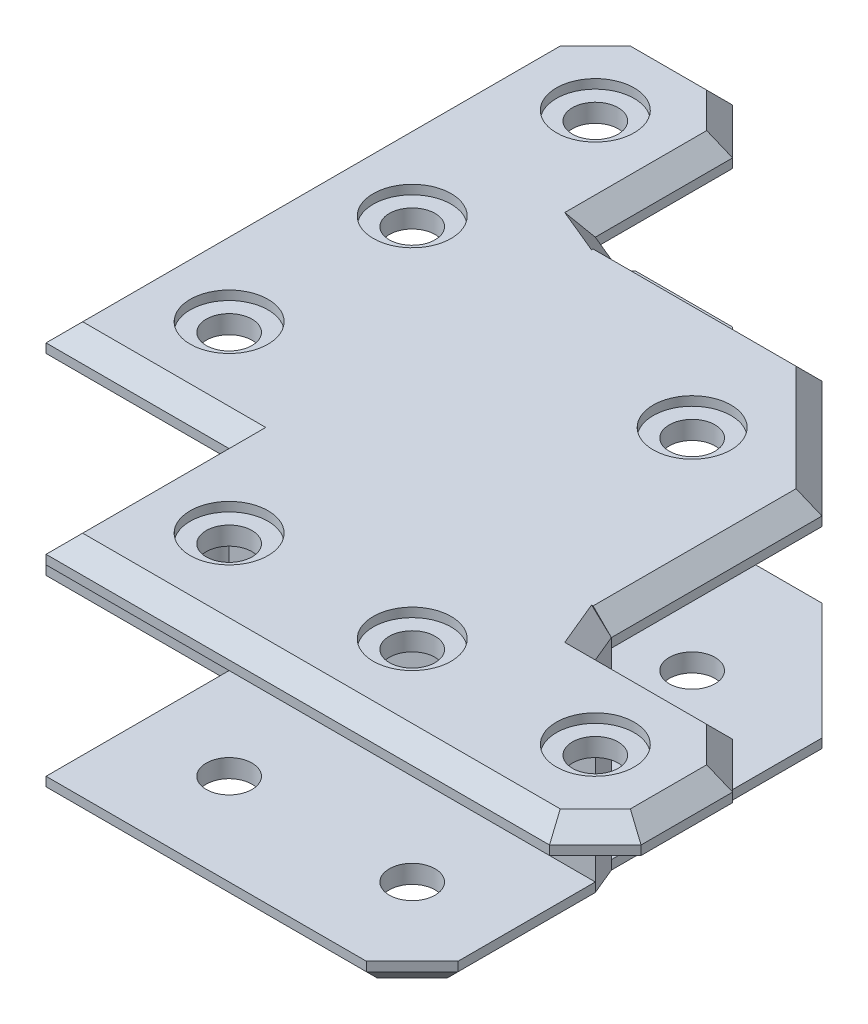
from build123d import *
from OCP.BRepFilletAPI import BRepFilletAPI_MakeChamfer

# Parameters (mm, degrees)
SKETCH1_W                    = 20
SKETCH1_H                    = 80
SKETCH1_W_2                  = 60
SKETCH1_H_2                  = 20
BOSS_EXTRUDE1_DEPTH          = 3
EXTRUDE_THIN10_DEPTH         = 3
SKETCH5_W                    = 20
SKETCH5_H                    = 20
CUT_EXTRUDE2_DEPTH           = 3
SKETCH6_R                    = 2.5
CUT_EXTRUDE3_DEPTH           = 10
BOSS_EXTRUDE7_DEPTH          = 23
SKETCH8_W                    = 0.297396294
SKETCH8_H                    = 3
BOSS_EXTRUDE8_DEPTH          = 23
SKETCH13_W                   = 3
SKETCH13_H                   = 35.56274761
BOSS_EXTRUDE9_DEPTH          = 26
SKETCH14_W                   = 3
SKETCH14_H                   = 1.444164959
BOSS_EXTRUDE10_DEPTH         = 23
CUT_EXTRUDE_THIN2_DEPTH      = 116.451288429
CUT_EXTRUDE_THIN2_DEPTH_BACK = 31
SKETCH16_W                   = 60
SKETCH16_H                   = 20
BOSS_EXTRUDE11_DEPTH         = 3
SKETCH18_W                   = 1.4
SKETCH18_H                   = 3
BOSS_EXTRUDE12_DEPTH         = 23
SKETCH19_R                   = 2.5
CUT_EXTRUDE10_DEPTH          = 30
SKETCH20_W                   = 20
SKETCH20_H                   = 60
BOSS_EXTRUDE13_DEPTH         = 3
SKETCH21_R                   = 2.5
CUT_EXTRUDE12_DEPTH          = 3
SKETCH22_R                   = 2.5
CUT_EXTRUDE13_DEPTH          = 3
SKETCH23_R                   = 2.5
CUT_EXTRUDE14_DEPTH          = 3
CUT_EXTRUDE_THIN3_DEPTH      = 117.086174887
CUT_EXTRUDE_THIN3_DEPTH_BACK = 3
CUT_EXTRUDE_THIN4_DEPTH      = 117.086174887
CUT_EXTRUDE_THIN4_DEPTH_BACK = 30
CUT_EXTRUDE_THIN5_START      = -58
CUT_EXTRUDE_THIN5_OUTLINE_W  = 10
CUT_EXTRUDE_THIN5_OUTLINE_H  = 29
CUT_EXTRUDE_THIN5_DEPTH      = 4.521306028
CUT_EXTRUDE_THIN6_DEPTH      = 117.086174887
CUT_EXTRUDE_THIN6_DEPTH_BACK = 30
SKETCH31_W                   = 21
SKETCH31_H                   = 20
CUT_EXTRUDE_THIN7_DEPTH      = 3
CUT_EXTRUDE15_DEPTH          = 117.086174887
CUT_EXTRUDE15_DEPTH_BACK     = 3
CHAMFER12_SIZE               = 2
CHAMFER13_SIZE               = 2
CHAMFER14_SIZE               = 2
CHAMFER17_SIZE               = 2
CHAMFER19_SIZE               = 2
SKETCH34_R                   = 4.25
SKETCH34_R_2                 = 2.5
CUT_EXTRUDE16_DEPTH          = 1
CUT_EXTRUDE17_START          = -1
SKETCH35_R                   = 4.25
CUT_EXTRUDE17_DEPTH          = 1
SKETCH37_R                   = 4.25
CUT_EXTRUDE18_DEPTH          = 1
SKETCH38_R                   = 4.25
CUT_EXTRUDE19_DEPTH          = 1
BOSS_EXTRUDE16_DEPTH         = 3
SKETCH41_W                   = 37.632579405
SKETCH41_H                   = 10.938249111
CUT_EXTRUDE20_DEPTH          = 40
SKETCH44_W                   = 41
SKETCH44_H                   = 23
EXTRUDE_THIN11_DEPTH         = 3
EXTRUDE_THIN12_DEPTH         = 3
CHAMFER20_SIZE               = 2
CHAMFER21_SIZE               = 2
CHAMFER21_SIZE2              = 1.965988204
CHAMFER21_SIZE2_2            = 2.035840382
CHAMFER22_SIZE               = 2
CHAMFER23_SIZE               = 2
CUT_EXTRUDE28_DEPTH          = 1
SKETCH45_R                   = 2.5
CUT_EXTRUDE29_DEPTH          = 41
SKETCH47_R                   = 4.25
CUT_EXTRUDE30_DEPTH          = 1


with BuildPart() as part:
    # Sketch1 → Boss-Extrude1 (new body)
    with BuildSketch(Plane(origin=(0, 0, 0), x_dir=(1, 0, 0), z_dir=(0, 1, 0))):
        with Locations((10, 40)):
            Rectangle(SKETCH1_W, SKETCH1_H)
        with Locations((50, 10)):
            Rectangle(SKETCH1_W_2, SKETCH1_H_2)
    extrude(amount=BOSS_EXTRUDE1_DEPTH)

    # Sketch3 → Extrude-Thin10 (add)
    with BuildSketch(Plane(origin=(0, 3, 0), x_dir=(1, 0, 0), z_dir=(0, 1, 0))):
        Polygon((20, 60.000000002), (48.284271248, 48.28427125), (60, 20), (23.044818699, 4.692662707), (17.669596658, 17.669596661), (4.692662706, 23.044818701), align=None)
    extrude(amount=-EXTRUDE_THIN10_DEPTH)

    # Sketch5 → Cut-Extrude2 (cut)
    with BuildSketch(Plane(origin=(0, 0, 0), x_dir=(1, 0, 0), z_dir=(0, 1, 0))):
        with Locations((10, 10)):
            Rectangle(SKETCH5_W, SKETCH5_H)
    extrude(amount=CUT_EXTRUDE2_DEPTH, mode=Mode.SUBTRACT)

    # Sketch6 → Cut-Extrude3 (cut)
    with BuildSketch(Plane(origin=(0, 3, 0), x_dir=(1, 0, 0), z_dir=(0, 1, 0))):
        with Locations(Location((30, 10, 0), (0, 0, 270))):
            Circle(SKETCH6_R)
        with Locations(Location((50, 10, 0), (0, 0, 270))):
            Circle(SKETCH6_R)
        with Locations(Location((70, 10, 0), (0, 0, 270))):
            Circle(SKETCH6_R)
        with Locations(Location((10, 30, 0), (0, 0, 270))):
            Circle(SKETCH6_R)
        with Locations(Location((10, 50, 0), (0, 0, 270))):
            Circle(SKETCH6_R)
        with Locations(Location((10, 70, 0), (0, 0, 270))):
            Circle(SKETCH6_R)
    extrude(amount=-CUT_EXTRUDE3_DEPTH, mode=Mode.SUBTRACT)

    # Sketch7 → Boss-Extrude7 (add)
    with BuildSketch(Plane(origin=(0, 3, 0), x_dir=(1, 0, 0), z_dir=(0, 1, 0))):
        Polygon((21.395504865, 23), (21.395504865, 20), (60, 20), (58.757359313, 23), align=None)
    extrude(amount=BOSS_EXTRUDE7_DEPTH)

    # Sketch8 → Boss-Extrude8 (add)
    with BuildSketch(Plane(origin=(0, 0, 0), x_dir=(1, 0, 0), z_dir=(0, 1, 0))):
        with Locations((20.148698147, 21.5)):
            Rectangle(SKETCH8_W, SKETCH8_H)
    extrude(amount=BOSS_EXTRUDE8_DEPTH)

    # Sketch13 → Boss-Extrude9 (add)
    with BuildSketch(Plane(origin=(0, 0, 0), x_dir=(1, 0, 0), z_dir=(0, 1, 0))):
        with Locations((21.5, 40.781373805)):
            Rectangle(SKETCH13_W, SKETCH13_H)
    extrude(amount=BOSS_EXTRUDE9_DEPTH)

    # Sketch14 → Boss-Extrude10 (add)
    with BuildSketch(Plane(origin=(0, 3, 0), x_dir=(1, 0, 0), z_dir=(0, 1, 0))):
        with Locations((21.5, 59.277917521)):
            Rectangle(SKETCH14_W, SKETCH14_H)
    extrude(amount=BOSS_EXTRUDE10_DEPTH)

    # Sketch15 → Cut-Extrude-Thin2 (cut, two sides: drawn at the far end of the back side and taken through both)
    with BuildSketch(Plane(origin=(0, 3, 0), x_dir=(-1, 0, 0), z_dir=(0, -1, 0)).offset(-CUT_EXTRUDE_THIN2_DEPTH_BACK)):
        Polygon((-20, 60), (-48.28, 48.28), (-49.42855555, 51.051429261), (-21.14855555, 62.771429261), align=None)
    extrude(amount=CUT_EXTRUDE_THIN2_DEPTH + CUT_EXTRUDE_THIN2_DEPTH_BACK, mode=Mode.SUBTRACT)



with BuildPart() as body_2:
    # Sketch16 → Boss-Extrude11 (new body)
    with BuildSketch(Plane(origin=(0, 26, 0), x_dir=(1, 0, 0), z_dir=(0, 1, 0))):
        with Locations((50, 10)):
            Rectangle(SKETCH16_W, SKETCH16_H)
    extrude(amount=-BOSS_EXTRUDE11_DEPTH)


with BuildPart() as part_1:
    add(part.part)

    add(body_2.part)  # Boss-Extrude12 merges body 2
    # Sketch18 → Boss-Extrude12 (add)
    with BuildSketch(Plane(origin=(0, 3, 0), x_dir=(1, 0, 0), z_dir=(0, 1, 0))):
        with Locations((20.7, 21.5)):
            Rectangle(SKETCH18_W, SKETCH18_H)
    extrude(amount=BOSS_EXTRUDE12_DEPTH)

    # Sketch19 → Cut-Extrude10 (cut)
    with BuildSketch(Plane(origin=(0, 26, 0), x_dir=(1, 0, 0), z_dir=(0, 1, 0))):
        with Locations(Location((50, 10, 0), (0, 0, 270))):
            Circle(SKETCH19_R)
        with Locations(Location((30, 10, 0), (0, 0, 270))):
            Circle(SKETCH19_R)
        with Locations(Location((70, 10, 0), (0, 0, 270))):
            Circle(SKETCH19_R)
    extrude(amount=-CUT_EXTRUDE10_DEPTH, mode=Mode.SUBTRACT)

    # Sketch20 → Boss-Extrude13 (add)
    with BuildSketch(Plane(origin=(0, 26, 0), x_dir=(1, 0, 0), z_dir=(0, 1, 0))):
        with Locations((10, 50)):
            Rectangle(SKETCH20_W, SKETCH20_H)
    extrude(amount=-BOSS_EXTRUDE13_DEPTH)

    # Sketch21 → Cut-Extrude12 (cut)
    with BuildSketch(Plane(origin=(0, 0, -23), x_dir=(-1, 0, 0), z_dir=(0, 0, -1))):
        with Locations((-50, 13)):
            Circle(SKETCH21_R)
        with Locations((-30, 13)):
            Circle(SKETCH21_R)
    extrude(amount=-CUT_EXTRUDE12_DEPTH, mode=Mode.SUBTRACT)

    # Sketch22 → Cut-Extrude13 (cut)
    with BuildSketch(Plane(origin=(23, 0, 0), x_dir=(0, 0, -1), z_dir=(1, 0, 0))):
        with Locations((30, 13)):
            Circle(SKETCH22_R)
        with Locations((50, 13)):
            Circle(SKETCH22_R)
    extrude(amount=-CUT_EXTRUDE13_DEPTH, mode=Mode.SUBTRACT)

    # Sketch23 → Cut-Extrude14 (cut)
    with BuildSketch(Plane(origin=(0, 26, 0), x_dir=(1, 0, 0), z_dir=(0, 1, 0))):
        with Locations(Location((10, 30, 0), (0, 0, 270))):
            Circle(SKETCH23_R)
        with Locations(Location((10, 50, 0), (0, 0, 270))):
            Circle(SKETCH23_R)
        with Locations(Location((10, 70, 0), (0, 0, 270))):
            Circle(SKETCH23_R)
    extrude(amount=-CUT_EXTRUDE14_DEPTH, mode=Mode.SUBTRACT)

    # Sketch24 → Cut-Extrude-Thin3 (cut, two sides: drawn at the far end of the back side and taken through both)
    with BuildSketch(Plane(origin=(0, 0, 0), x_dir=(1, 0, 0), z_dir=(0, 1, 0)).offset(-CUT_EXTRUDE_THIN3_DEPTH_BACK)):
        Polygon((80, 5), (75, 0), (78.535533906, -3.535533906), (83.535533906, 1.464466094), align=None)
    extrude(amount=CUT_EXTRUDE_THIN3_DEPTH + CUT_EXTRUDE_THIN3_DEPTH_BACK, mode=Mode.SUBTRACT)

    # Sketch27 → Cut-Extrude-Thin4 (cut, two sides: drawn at the far end of the back side and taken through both)
    with BuildSketch(Plane(origin=(0, 26, 0), x_dir=(1, 0, 0), z_dir=(0, 1, 0)).offset(-CUT_EXTRUDE_THIN4_DEPTH_BACK)):
        Polygon((75, 20), (80, 15), (83.535533906, 18.535533906), (78.535533906, 23.535533906), align=None)
    extrude(amount=CUT_EXTRUDE_THIN4_DEPTH + CUT_EXTRUDE_THIN4_DEPTH_BACK, mode=Mode.SUBTRACT)

    # Cut-Extrude-Thin5: read off the stored shape, not the designer's step
    # Cut-Extrude-Thin5 outline → Cut-Extrude-Thin5 (cut)
    with BuildSketch(Plane(origin=(0, 0, 0), x_dir=(0.7072144605741779, 0.017447091479365764, -0.706783775813852), z_dir=(0.7069990853988247, -0.017452406437283494, 0.7069990853988237)).offset(CUT_EXTRUDE_THIN5_START)):
        with Locations((57, 11.5)):
            Rectangle(CUT_EXTRUDE_THIN5_OUTLINE_W, CUT_EXTRUDE_THIN5_OUTLINE_H)
    extrude(amount=CUT_EXTRUDE_THIN5_DEPTH, mode=Mode.SUBTRACT)

    # Sketch29 → Cut-Extrude-Thin6 (cut, two sides: drawn at the far end of the back side and taken through both)
    with BuildSketch(Plane(origin=(0, 26, 0), x_dir=(1, 0, 0), z_dir=(0, 1, 0)).offset(-CUT_EXTRUDE_THIN6_DEPTH_BACK)):
        Polygon((15, 80), (20, 75), (23.535533906, 78.535533906), (18.535533906, 83.535533906), align=None)
    extrude(amount=CUT_EXTRUDE_THIN6_DEPTH + CUT_EXTRUDE_THIN6_DEPTH_BACK, mode=Mode.SUBTRACT)

    # Sketch31 → Cut-Extrude-Thin7 (cut)
    with BuildSketch(Plane.XZ):
        with Locations((70.5, -10)):
            Rectangle(SKETCH31_W, SKETCH31_H)
    extrude(amount=-CUT_EXTRUDE_THIN7_DEPTH, mode=Mode.SUBTRACT)

    # Sketch32 → Cut-Extrude15 (cut, two sides: drawn at the far end of the back side and taken through both)
    with BuildSketch(Plane.XZ.offset(-CUT_EXTRUDE15_DEPTH_BACK)):
        Polygon((-89.366369989, 144.366369989), (55, 0), (60, -5), (204.366369989, -149.366369989), (493.099109968, 139.366369989), (199.366369989, 433.099109968), align=None)
    extrude(amount=CUT_EXTRUDE15_DEPTH + CUT_EXTRUDE15_DEPTH_BACK, mode=Mode.SUBTRACT)

    # Chamfer12
    chamfer12_edges = [part_1.edges().sort_by_distance(p)[0] for p in [
        (20, 26, -67.5),
    ]]
    chamfer(chamfer12_edges, length=CHAMFER12_SIZE)

    # Chamfer13
    chamfer13_edges = [part_1.edges().sort_by_distance(p)[0] for p in [
        (47.5, 26, 0),
        (10, 26, -20),
        (77.5, 26, -17.5),
    ]]
    chamfer(chamfer13_edges, length=CHAMFER13_SIZE)

    # Chamfer14
    chamfer14_edges = [part_1.edges().sort_by_distance(p)[0] for p in [
        (20, 0, -67.500000001),
        (0, 0, -47.820907464),
        (9.679092536, 0, -80),
        (10, 26, -80),
        (0, 26, -48.5),
        (20, 26, -12),
        (80, 26, -8.585786438),
    ]]
    chamfer(chamfer14_edges, length=CHAMFER14_SIZE)

    # Chamfer17
    chamfer17_edges = [part_1.edges().sort_by_distance(p)[0] for p in [
        (66.085786438, 26, -20),
    ]]
    chamfer(chamfer17_edges, length=CHAMFER17_SIZE)

    # Chamfer19
    chamfer19_edges = [part_1.edges().sort_by_distance(p)[0] for p in [
        (37.5, 0, 0),
    ]]
    chamfer(chamfer19_edges, length=CHAMFER19_SIZE)

    # Sketch34 → Cut-Extrude16 (cut)
    # profile 1 of 6: a face of its own
    with BuildSketch(Plane(origin=(0, 26, 0), x_dir=(1, 0, 0), z_dir=(0, 1, 0))):
        with Locations(Location((10, 30, 0), (0, 0, 270))):
            Circle(SKETCH34_R)
        with Locations(Location((10, 30, 0), (0, 0, 270))):
            Circle(SKETCH34_R_2, mode=Mode.SUBTRACT)
    # profile 2 of 6: a face of its own
    with BuildSketch(Plane(origin=(0, 26, 0), x_dir=(1, 0, 0), z_dir=(0, 1, 0))):
        with Locations(Location((10, 70, 0), (0, 0, 270))):
            Circle(SKETCH34_R)
        with Locations(Location((10, 70, 0), (0, 0, 270))):
            Circle(SKETCH34_R_2, mode=Mode.SUBTRACT)
    # profile 3 of 6: a face of its own
    with BuildSketch(Plane(origin=(0, 26, 0), x_dir=(1, 0, 0), z_dir=(0, 1, 0))):
        with Locations(Location((30, 10, 0), (0, 0, 270))):
            Circle(SKETCH34_R)
        with Locations(Location((30, 10, 0), (0, 0, 270))):
            Circle(SKETCH34_R_2, mode=Mode.SUBTRACT)
    # profile 4 of 6: a face of its own
    with BuildSketch(Plane(origin=(0, 26, 0), x_dir=(1, 0, 0), z_dir=(0, 1, 0))):
        with Locations(Location((50, 10, 0), (0, 0, 270))):
            Circle(SKETCH34_R)
        with Locations(Location((50, 10, 0), (0, 0, 270))):
            Circle(SKETCH34_R_2, mode=Mode.SUBTRACT)
    # profile 5 of 6: a face of its own
    with BuildSketch(Plane(origin=(0, 26, 0), x_dir=(1, 0, 0), z_dir=(0, 1, 0))):
        with Locations(Location((70, 10, 0), (0, 0, 270))):
            Circle(SKETCH34_R)
        with Locations(Location((70, 10, 0), (0, 0, 270))):
            Circle(SKETCH34_R_2, mode=Mode.SUBTRACT)
    # profile 6 of 6: a face of its own
    with BuildSketch(Plane(origin=(0, 26, 0), x_dir=(1, 0, 0), z_dir=(0, 1, 0))):
        with Locations(Location((10, 50, 0), (0, 0, 270))):
            Circle(SKETCH34_R)
    extrude(amount=-CUT_EXTRUDE16_DEPTH, mode=Mode.SUBTRACT)

    # Sketch35 → Cut-Extrude17 (cut)
    with BuildSketch(Plane.XZ.offset(CUT_EXTRUDE17_START)):
        with Locations(Location((50, -10, 0), (0, 0, 90))):
            Circle(SKETCH35_R)
        with Locations(Location((30, -10, 0), (0, 0, 90))):
            Circle(SKETCH35_R)
        with Locations(Location((10, -30, 0), (0, 0, 90))):
            Circle(SKETCH35_R)
        with Locations(Location((10, -50, 0), (0, 0, 90))):
            Circle(SKETCH35_R)
        with Locations(Location((10, -70, 0), (0, 0, 90))):
            Circle(SKETCH35_R)
    extrude(amount=CUT_EXTRUDE17_DEPTH, mode=Mode.SUBTRACT)

    # Sketch37 → Cut-Extrude18 (cut)
    with BuildSketch(Plane(origin=(0, 0, -23), x_dir=(-1, 0, 0), z_dir=(0, 0, -1))):
        with Locations((-50, 13)):
            Circle(SKETCH37_R)
        with Locations((-30, 13)):
            Circle(SKETCH37_R)
    extrude(amount=-CUT_EXTRUDE18_DEPTH, mode=Mode.SUBTRACT)

    # Sketch38 → Cut-Extrude19 (cut)
    with BuildSketch(Plane(origin=(23, 0, 0), x_dir=(0, 0, -1), z_dir=(1, 0, 0))):
        with Locations((30, 13)):
            Circle(SKETCH38_R)
        with Locations((50, 13)):
            Circle(SKETCH38_R)
    extrude(amount=-CUT_EXTRUDE19_DEPTH, mode=Mode.SUBTRACT)

    # Sketch30 → Boss-Extrude16 (add)
    with BuildSketch(Plane(origin=(0, 26, 0), x_dir=(1, 0, 0), z_dir=(0, 1, 0))):
        Polygon((58.76, 23), (58.76, 46), (46, 58.76), (23, 58.76), (23, 23), align=None)
    extrude(amount=-BOSS_EXTRUDE16_DEPTH)

    # Sketch41 → Cut-Extrude20 (cut)
    with BuildSketch(Plane(origin=(0, 0, -23), x_dir=(-1, 0, 0), z_dir=(0, 0, -1))):
        with Locations((-41.816289703, -2.469124556)):
            Rectangle(SKETCH41_W, SKETCH41_H)
    extrude(amount=CUT_EXTRUDE20_DEPTH, mode=Mode.SUBTRACT)

    # Sketch44 → Extrude-Thin11 (add)
    with BuildSketch(Plane(origin=(0, 0, 0), x_dir=(-1, 0, 0), z_dir=(0, -1, 0))):
        with Locations((-38.26, 34.5)):
            Rectangle(SKETCH44_W, SKETCH44_H)
    extrude(amount=-EXTRUDE_THIN11_DEPTH)

    # Sketch43 → Extrude-Thin12 (add)
    with BuildSketch(Plane(origin=(0, 0, 0), x_dir=(-1, 0, 0), z_dir=(0, -1, 0))):
        Polygon((-23, 58.76), (-46, 58.76), (-58.76, 46), (-29.768621971, 17.008621971), (-29.017243943, 17.76), (-23, 17.76), align=None)
    extrude(amount=-EXTRUDE_THIN12_DEPTH)

    # Chamfer20
    # the kernel refuses this chamfer: 2 mm, written as the material it takes off along each edge
    with BuildSketch(Plane(origin=(20, 0, -20), x_dir=(0, 1, 0), z_dir=(-1, 0, 0))) as chamfer20_piece_1:
        Polygon((CHAMFER20_SIZE, 0), (0, CHAMFER20_SIZE), (0, 0), align=None)
    extrude(amount=23.143365976, mode=Mode.SUBTRACT)
    with BuildSketch(Plane(origin=(27.751491656, 0, -56.787571351), x_dir=(0, 1, 0), z_dir=(-0.9238097537211767, 0, -0.38285184984484394))) as chamfer20_piece_2_section:
        Polygon((CHAMFER20_SIZE, 0), (0, -CHAMFER20_SIZE), (0, 0), align=None)
    chamfer20_piece_2 = extrude(amount=15.699101739, mode=Mode.PRIVATE)
    chamfer20_piece_2 = split(chamfer20_piece_2, bisect_by=Plane(origin=(22.875745828, 4.875745828, -56.787571351), z_dir=(0.7071067811865476, -0.7071067811865476, 0)), keep=Keep.TOP, mode=Mode.PRIVATE)
    chamfer20_piece_2 = split(chamfer20_piece_2, bisect_by=Plane(origin=(23, 0, -56.787571351), z_dir=(-1, 0, 0)), keep=Keep.TOP, mode=Mode.PRIVATE)
    add(chamfer20_piece_2, mode=Mode.SUBTRACT)
    with BuildSketch(Plane(origin=(42.36309104, 0, -62.39690896), x_dir=(0, 1, 0), z_dir=(0.7071067811865476, 0, 0.7071067811865476))) as chamfer20_piece_3:
        Polygon((CHAMFER20_SIZE, 0), (0, CHAMFER20_SIZE), (0, 0), align=None)
    extrude(amount=28.332097008, mode=Mode.SUBTRACT)
    with BuildSketch(Plane(origin=(53.36309104, 0, 1.63690896), x_dir=(0, 1, 0), z_dir=(0.7071067811865476, 0, -0.7071067811865476))) as chamfer20_piece_4:
        Polygon((CHAMFER20_SIZE, 0), (0, -CHAMFER20_SIZE), (0, 0), align=None)
    extrude(amount=14.529372639, mode=Mode.SUBTRACT)
    with BuildSketch(Plane(origin=(56.789078368, 0, -27.751850553), x_dir=(0, 1, 0), z_dir=(0.38268343233471624, 0, 0.9238795325238679))) as chamfer20_piece_5_section:
        Polygon((CHAMFER20_SIZE, 0), (0, CHAMFER20_SIZE), (0, 0), align=None)
    chamfer20_piece_5 = extrude(amount=13.533908553, mode=Mode.PRIVATE)
    chamfer20_piece_5 = split(chamfer20_piece_5, bisect_by=Plane(origin=(56.789078368, 0, -23), z_dir=(0, 0, 1)), keep=Keep.TOP, mode=Mode.PRIVATE)
    add(chamfer20_piece_5, mode=Mode.SUBTRACT)
    with BuildSketch(Plane(origin=(56.789078368, 26, -27.751850553), x_dir=(0, -1, 0), z_dir=(0.3826834323347171, 0, 0.9238795325238676))) as chamfer20_piece_6_section:
        Polygon((CHAMFER20_SIZE, 0), (0, -CHAMFER20_SIZE), (0, 0), align=None)
    chamfer20_piece_6 = extrude(amount=15.698692953, mode=Mode.PRIVATE)
    chamfer20_piece_6 = split(chamfer20_piece_6, bisect_by=Plane(origin=(56.789078368, 21.124074723, -22.875925277), z_dir=(0, 0.7071067811865476, -0.7071067811865476)), keep=Keep.TOP, mode=Mode.PRIVATE)
    chamfer20_piece_6 = split(chamfer20_piece_6, bisect_by=Plane(origin=(56.789078368, 26, -23), z_dir=(0, 0, 1)), keep=Keep.TOP, mode=Mode.PRIVATE)
    add(chamfer20_piece_6, mode=Mode.SUBTRACT)
    with BuildSketch(Plane(origin=(51.143365976, 26, -58.76), x_dir=(0, -1, 0), z_dir=(-1, 0, 0))) as chamfer20_piece_7_section:
        Polygon((CHAMFER20_SIZE, 0), (0, CHAMFER20_SIZE), (0, 0), align=None)
    chamfer20_piece_7 = extrude(amount=33.286731952, mode=Mode.PRIVATE)
    chamfer20_piece_7 = split(chamfer20_piece_7, bisect_by=Plane(origin=(47.017076343, 26, -48.803389861), z_dir=(0.38285184984484405, 0, -0.9238097537211767)), keep=Keep.TOP, mode=Mode.PRIVATE)
    add(chamfer20_piece_7, mode=Mode.SUBTRACT)

    # Chamfer21: one chamfer whose edges measure the first distance from different faces: ONE call of the kernel's chamfer builder (chamfer() names one face for all edges)
    chamfer21_edges_1 = [part_1.edges().sort_by_distance(p)[0] for p in [
        (2.179092536, 0, -77.820907464),
    ]]
    chamfer21_side_1 = [part_1.faces().sort_by_distance(p)[0] for p in [
        (2.202160005, 1.868931891, -77.797839995),
    ]]
    chamfer21_edges_2 = [part_1.edges().sort_by_distance(p)[0] for p in [
        (17.5, 0, -77.5),
        (33.085786438, 0, -58.76),
        (58.76, 0, -33.085786438),
        (77.5, 26, -2.5),
        (58.76, 26, -34.5),
        (53.38, 26, -51.38),
        (17.5, 26, -77.5),
    ]]
    chamfer21_edges_3 = [part_1.edges().sort_by_distance(p)[0] for p in [
        (2.5, 26, -77.5),
    ]]
    chamfer21_side_3 = [part_1.faces().sort_by_distance(p)[0] for p in [
        (33.801139056, 26, -33.763899978),
    ]]
    chamfer21 = BRepFilletAPI_MakeChamfer(part_1.part.solid().wrapped)
    for e in chamfer21_edges_1:
        chamfer21.Add(CHAMFER21_SIZE, CHAMFER21_SIZE2, e.wrapped, chamfer21_side_1[0].wrapped)  # the first distance lies on this face
    for e in chamfer21_edges_2:
        chamfer21.Add(CHAMFER21_SIZE, e.wrapped)
    for e in chamfer21_edges_3:
        chamfer21.Add(CHAMFER21_SIZE, CHAMFER21_SIZE2_2, e.wrapped, chamfer21_side_3[0].wrapped)  # the first distance lies on this face
    add(Compound.cast(chamfer21.Shape()), mode=Mode.REPLACE)

    # Chamfer22
    # the kernel refuses this chamfer: 2 mm, written as the material it takes off along each edge
    with BuildSketch(Plane(origin=(13.248508344, 26, -62.798001492), x_dir=(0, -1, 0), z_dir=(0.9238097537213213, 0, 0.3828518498444948))) as chamfer22_piece_1_section:
        Polygon((CHAMFER22_SIZE, 0), (0, -CHAMFER22_SIZE), (0, 0), align=None)
    chamfer22_piece_1 = extrude(amount=20.914483432, mode=Mode.PRIVATE)
    chamfer22_piece_1 = split(chamfer22_piece_1, bisect_by=Plane(origin=(13.248508344, 22.980999254, -59.779000746), z_dir=(0, 0.7071067811865476, -0.7071067811865476)), keep=Keep.TOP, mode=Mode.PRIVATE)
    chamfer22_piece_1 = split(chamfer22_piece_1, bisect_by=Plane(origin=(15.624254172, 28.375745828, -62.798001492), z_dir=(0.7071067811865476, 0.7071067811865476, 0)), keep=Keep.TOP, mode=Mode.PRIVATE)
    add(chamfer22_piece_1, mode=Mode.SUBTRACT)
    with BuildSketch(Plane(origin=(13.248508344, 26, -62.798001492), x_dir=(0, -1, 0), z_dir=(0.9238097537213213, 0, 0.3828518498444948))) as chamfer22_piece_2_section:
        Polygon((CHAMFER22_SIZE, 0), (0, -CHAMFER22_SIZE), (0, 0), align=None)
    chamfer22_piece_2 = extrude(amount=20.914483432, mode=Mode.PRIVATE)
    chamfer22_piece_2 = split(chamfer22_piece_2, bisect_by=Plane(origin=(23, 26, -62.798001492), z_dir=(-1, 0, 0)), keep=Keep.TOP, mode=Mode.PRIVATE)
    chamfer22_piece_2 = split(chamfer22_piece_2, bisect_by=Plane(origin=(20, 26, -62.798001492), z_dir=(1, 0, 0)), keep=Keep.TOP, mode=Mode.PRIVATE)
    add(chamfer22_piece_2, mode=Mode.SUBTRACT)
    with BuildSketch(Plane(origin=(60, 0, -23.517470299), x_dir=(-1, 0, 0), z_dir=(0, 0, 1))) as chamfer22_piece_3:
        Polygon((CHAMFER22_SIZE, 0), (0, -CHAMFER22_SIZE), (0, 0), align=None)
    extrude(amount=20.83240915, mode=Mode.SUBTRACT)

    # Chamfer23
    chamfer23_edges = [part_1.edges().sort_by_distance(p)[0] for p in [
        (20, 0, -12),
    ]]
    chamfer(chamfer23_edges, length=CHAMFER23_SIZE)

    # Sketch46 → Cut-Extrude28 (cut)
    with BuildSketch(Plane(origin=(0, 0, 0), x_dir=(-1, 0, 0), z_dir=(0, -1, 0))):
        Polygon((-48.545986324, 42.024013676), (-44.084566037, 40.828579713), (-40.818579713, 44.094566037), (-42.014013676, 48.555986324), (-46.475433963, 49.751420287), (-49.741420287, 46.485433963), align=None)
    extrude(amount=-CUT_EXTRUDE28_DEPTH, mode=Mode.SUBTRACT)

    # Sketch45 → Cut-Extrude29 (cut)
    with BuildSketch(Plane(origin=(0, 26, 0), x_dir=(1, 0, 0), z_dir=(0, 1, 0))):
        with Locations(Location((45.29, 45.29, 0), (0, 0, 270))):
            Circle(SKETCH45_R)
    extrude(amount=-CUT_EXTRUDE29_DEPTH, mode=Mode.SUBTRACT)

    # Sketch47 → Cut-Extrude30 (cut)
    with BuildSketch(Plane(origin=(0, 26, 0), x_dir=(1, 0, 0), z_dir=(0, 1, 0))):
        with Locations(Location((45.29, 45.29, 0), (0, 0, 270))):
            Circle(SKETCH47_R)
    extrude(amount=-CUT_EXTRUDE30_DEPTH, mode=Mode.SUBTRACT)


solid = part_1.part
